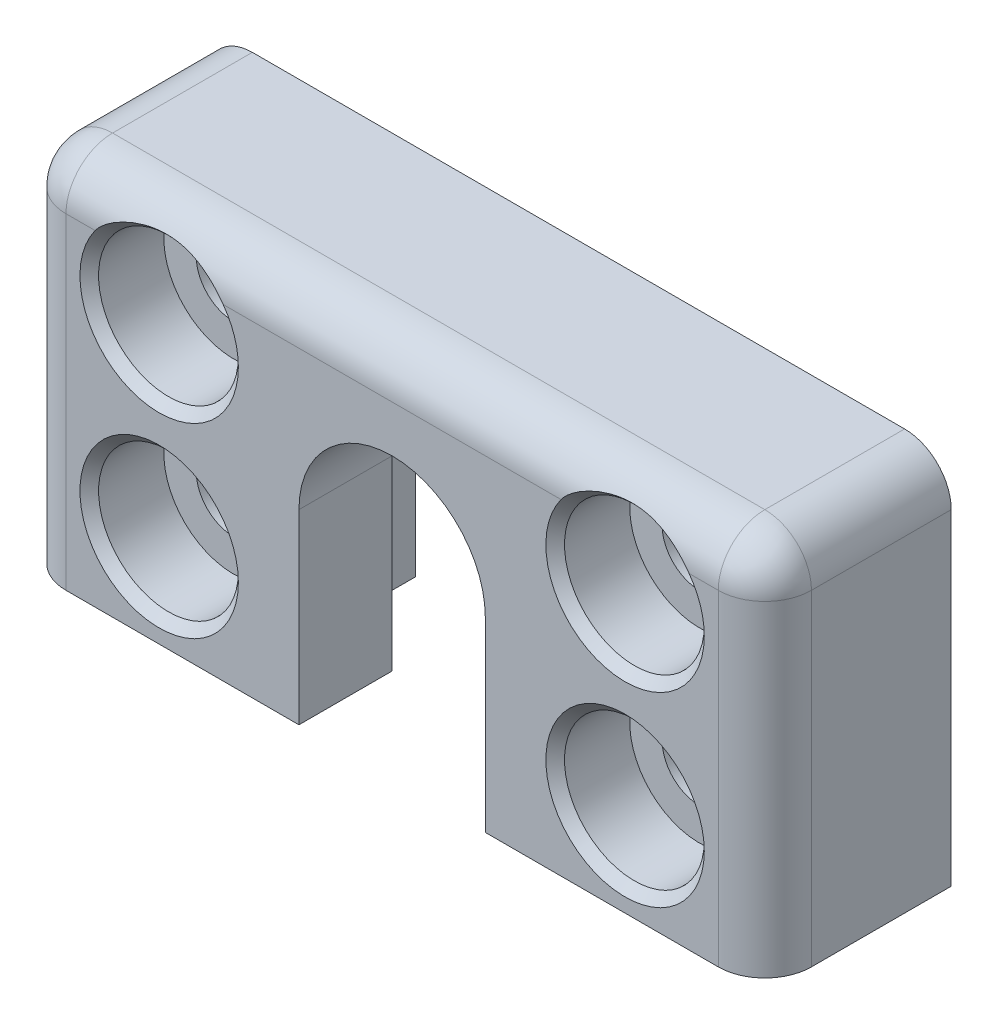
from build123d import *

# Parameters (mm, degrees)
SKETCH1_W                                    = 50.8
SKETCH1_H                                    = 25.4
BOSS_EXTRUDE1_DEPTH                          = 12.7
CBORE_FOR_10_SOCKET_HEAD_CAP_SCREW1_AT_COUNT = 2
CBORE_FOR_10_SOCKET_HEAD_CAP_SCREW1_AT_PITCH = 31.75
CBORE_FOR_10_SOCKET_HEAD_CAP_SCREW1_2_COUNT  = 2
CBORE_FOR_10_SOCKET_HEAD_CAP_SCREW1_2_PITCH  = 34.195796525
CBORE_FOR_10_SOCKET_HEAD_CAP_SCREW1_3_COUNT  = 2
CBORE_FOR_10_SOCKET_HEAD_CAP_SCREW1_3_PITCH  = 12.7
CUT_EXTRUDE1_REACH                           = 33.109
CUT_EXTRUDE2_DEPTH                           = 6.35
FILLET1_R                                    = 3.175


with BuildPart() as part:
    # Sketch1 → Boss-Extrude1 (new body)
    with BuildSketch(Plane.XY):
        Rectangle(SKETCH1_W, SKETCH1_H)
    extrude(amount=-BOSS_EXTRUDE1_DEPTH)

    # Sketch2 → CBORE for #10 Socket Head Cap Screw1 (revolve, cut)
    with BuildSketch(Plane(origin=(-15.875, 6.35, 0), x_dir=(0, -1, 0), z_dir=(1, 0, 0))):
        Polygon((0, 0), (0, 12.7), (2.5527, 12.7), (2.5527, 5.08), (4.7625, 5.08), (4.7625, 0.635), (5.3975, 0), align=None)
    cbore_for_10_socket_head_cap_screw1 = revolve(axis=Axis((-15.875, 6.35, 6.35), (0, 0, -1)), mode=Mode.SUBTRACT)

    # CBORE for #10 Socket Head Cap Screw1 at: CBORE for #10 Socket Head Cap Screw1 ×2
    with Locations(*[(i * CBORE_FOR_10_SOCKET_HEAD_CAP_SCREW1_AT_PITCH, 0, 0) for i in range(1, CBORE_FOR_10_SOCKET_HEAD_CAP_SCREW1_AT_COUNT)]):
        add(cbore_for_10_socket_head_cap_screw1, mode=Mode.SUBTRACT)

    # CBORE for _10 Socket Head Cap Screw1 2: CBORE for #10 Socket Head Cap Screw1 ×2
    with Locations(*[Vector(0.9284766908852594, -0.37139067635410367, 0) * (i * CBORE_FOR_10_SOCKET_HEAD_CAP_SCREW1_2_PITCH) for i in range(1, CBORE_FOR_10_SOCKET_HEAD_CAP_SCREW1_2_COUNT)]):
        add(cbore_for_10_socket_head_cap_screw1, mode=Mode.SUBTRACT)

    # CBORE for _10 Socket Head Cap Screw1 3: CBORE for #10 Socket Head Cap Screw1 ×2
    with Locations(*[(0, -i * CBORE_FOR_10_SOCKET_HEAD_CAP_SCREW1_3_PITCH, 0) for i in range(1, CBORE_FOR_10_SOCKET_HEAD_CAP_SCREW1_3_COUNT)]):
        add(cbore_for_10_socket_head_cap_screw1, mode=Mode.SUBTRACT)

    # Sketch4 → Cut-Extrude1 (cut, up to next)
    with BuildSketch(Plane.XY, mode=Mode.PRIVATE) as cut_extrude1_sk1:
        with BuildLine():
            Line((-6.35, 0), (-6.35, -12.7))
            Line((-6.35, -12.7), (6.35, -12.7))
            Line((6.35, -12.7), (6.35, 0))
            ThreePointArc((6.35, 0), (0, 6.35), (-6.35, 0))
        make_face()
    cut_extrude1_tool1 = extrude(cut_extrude1_sk1.sketch, amount=-CUT_EXTRUDE1_REACH, mode=Mode.PRIVATE) & part.part
    add(cut_extrude1_tool1.solids().sort_by_distance((0, -3.799576, 0))[0], mode=Mode.SUBTRACT)

    # Sketch5 → Cut-Extrude2 (cut)
    with BuildSketch(Plane(origin=(0, 0, -12.7), x_dir=(-1, 0, 0), z_dir=(0, 0, -1))):
        with BuildLine():
            Line((-11.1125, 0), (-11.1125, -12.7))
            Line((-11.1125, -12.7), (11.1125, -12.7))
            Line((11.1125, -12.7), (11.1125, 0))
            ThreePointArc((11.1125, 0), (0, 11.1125), (-11.1125, 0))
        make_face()
    extrude(amount=-CUT_EXTRUDE2_DEPTH, mode=Mode.SUBTRACT)

    # Fillet1
    # the kernel refuses this fillet: 3.175 mm, written as the material it takes off along each edge
    with BuildSketch(Plane(origin=(-22.225, 9.525, -3.175), x_dir=(-1, 0, 0), z_dir=(0, 1, 0))) as fillet1_piece_1_section:
        Polygon((0, 0), (FILLET1_R, 0), (FILLET1_R, FILLET1_R), (0, FILLET1_R), align=None)
    fillet1_piece_1 = extrude(amount=FILLET1_R, mode=Mode.PRIVATE)
    fillet1_piece_1 = fillet1_piece_1 - Plane(origin=(-22.225, 9.525, -3.175), x_dir=(0.7071067811865475, 0, -0.7071067811865475), z_dir=(0, 1, 0)) * Sphere(FILLET1_R, mode=Mode.PRIVATE)
    add(fillet1_piece_1, mode=Mode.SUBTRACT)
    with BuildSketch(Plane(origin=(22.225, 9.525, -3.175), x_dir=(1, 0, 0), z_dir=(0, 1, 0))) as fillet1_piece_2_section:
        Polygon((0, 0), (FILLET1_R, 0), (FILLET1_R, -FILLET1_R), (0, -FILLET1_R), align=None)
    fillet1_piece_2 = extrude(amount=FILLET1_R, mode=Mode.PRIVATE)
    fillet1_piece_2 = fillet1_piece_2 - Plane(origin=(22.225, 9.525, -3.175), x_dir=(-0.7071067811865475, 0, -0.7071067811865475), z_dir=(0, 1, 0)) * Sphere(FILLET1_R, mode=Mode.PRIVATE)
    add(fillet1_piece_2, mode=Mode.SUBTRACT)
    with BuildSketch(Plane(origin=(-25.4, -20.6375, 0), x_dir=(0, 0, -1), z_dir=(0, 1, 0)), Plane(origin=(25.4, 9.525, 0), x_dir=(0, 0, -1), z_dir=(0, -1, 0))) as fillet1_piece_3:
        with BuildLine():
            CenterArc((FILLET1_R, -FILLET1_R), FILLET1_R, 90, 90)
            Line((0, -FILLET1_R), (0, 0))
            Line((0, 0), (FILLET1_R, 0))
        make_face()
    extrude(amount=30.1625, mode=Mode.SUBTRACT)
    with BuildSketch(Plane(origin=(-22.225, 12.7, 0), x_dir=(0, 0, -1), z_dir=(1, 0, 0))) as fillet1_piece_4:
        with BuildLine():
            CenterArc((FILLET1_R, -FILLET1_R), FILLET1_R, 90, 90)
            Line((0, -FILLET1_R), (0, 0))
            Line((0, 0), (FILLET1_R, 0))
        make_face()
    extrude(amount=44.45, mode=Mode.SUBTRACT)
    with BuildSketch(Plane(origin=(-25.4, 12.7, -3.175), x_dir=(1, 0, 0), z_dir=(0, 0, -1))) as fillet1_piece_5:
        with BuildLine():
            CenterArc((FILLET1_R, FILLET1_R), FILLET1_R, 180, 90)
            Line((0, FILLET1_R), (0, 0))
            Line((0, 0), (FILLET1_R, 0))
        make_face()
    extrude(amount=17.4625, mode=Mode.SUBTRACT)
    with BuildSketch(Plane(origin=(25.4, 12.7, -3.175), x_dir=(-1, 0, 0), z_dir=(0, 0, -1))) as fillet1_piece_6:
        with BuildLine():
            CenterArc((FILLET1_R, -FILLET1_R), FILLET1_R, 90, 90)
            Line((0, -FILLET1_R), (0, 0))
            Line((0, 0), (FILLET1_R, 0))
        make_face()
    extrude(amount=17.4625, mode=Mode.SUBTRACT)


solid = part.part
